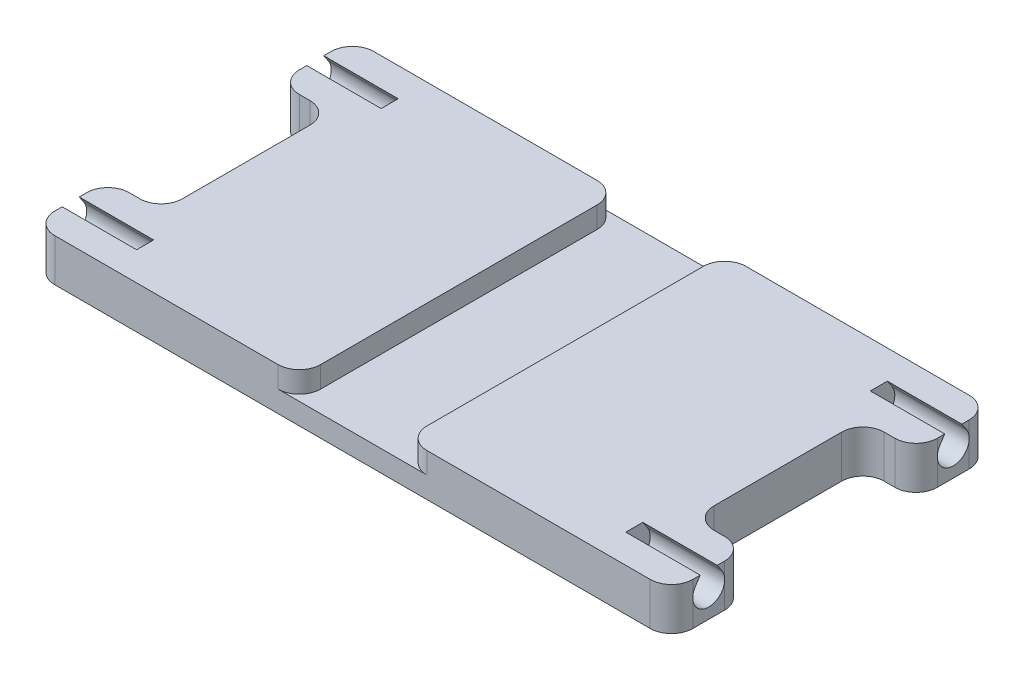
from build123d import *

# Parameters (mm, degrees)
BOSS_EXTRUDE1_DEPTH  = 2
CUT_EXTRUDE1_DEPTH   = 7
MIRROR2_COPY_1_DEPTH = 7
SKETCH4_W            = 10
SKETCH4_H            = 30
CUT_EXTRUDE2_DEPTH   = 2
FILLET1_R            = 2


with BuildPart() as part:
    # Sketch2 → Boss-Extrude1 (new, symmetric)
    with BuildSketch(Plane(origin=(0, 0, 0), x_dir=(1, 0, 0), z_dir=(0, 1, 0))):
        Polygon((-25, -8), (-30, -8), (-30, -15), (30, -15), (30, -8), (25, -8), (25, 8), (30, 8), (30, 15), (-30, 15), (-30, 8), (-25, 8), align=None)
    extrude(amount=BOSS_EXTRUDE1_DEPTH, both=True)

    # Sketch3 → Cut-Extrude1 (cut)
    with BuildSketch(Plane(origin=(30, 0, 0), x_dir=(0, 0, -1), z_dir=(1, 0, 0))):
        with BuildLine():
            Line((-12.3, 2), (-12.74567474, 1.335640138))
            ThreePointArc((-12.74567474, 1.335640138), (-11.5, -1), (-10.25432526, 1.335640138))
            Line((-10.25432526, 1.335640138), (-10.7, 2))
            Line((-10.7, 2), (-12.3, 2))
        make_face()
    cut_extrude1 = extrude(amount=-CUT_EXTRUDE1_DEPTH, mode=Mode.SUBTRACT)

    # Mirror1: Cut-Extrude1 across plane
    add(cut_extrude1.mirror(Plane(origin=(0, 0, 0), x_dir=(0, 0, 1), z_dir=(1, 0, 0))), mode=Mode.SUBTRACT)

    # Mirror2: Cut-Extrude1 across plane
    add(cut_extrude1.mirror(Plane.XY), mode=Mode.SUBTRACT)

    # Mirror2 copy 1 sketch → Mirror2 copy 1 (cut)
    with BuildSketch(Plane.ZY.offset(30)):
        with BuildLine():
            Line((-12.3, 2), (-12.74567474, 1.335640138))
            ThreePointArc((-12.74567474, 1.335640138), (-11.5, -1), (-10.25432526, 1.335640138))
            Line((-10.25432526, 1.335640138), (-10.7, 2))
            Line((-10.7, 2), (-12.3, 2))
        make_face()
    extrude(amount=-MIRROR2_COPY_1_DEPTH, mode=Mode.SUBTRACT)

    # Sketch4 → Cut-Extrude2 (cut)
    with BuildSketch(Plane(origin=(0, 2, 0), x_dir=(1, 0, 0), z_dir=(0, 1, 0))):
        Rectangle(SKETCH4_W, SKETCH4_H)
    extrude(amount=-CUT_EXTRUDE2_DEPTH, mode=Mode.SUBTRACT)

    # Fillet1
    fillet1_edges = [part.edges().sort_by_distance(p)[0] for p in [
        (5, 1, -15),
        (5, 1, 15),
        (-5, 1, 15),
        (-5, 1, -15),
        (-25, 0, -8),
        (-30, 0, -8),
        (-30, 0, -15),
        (30, 0, -15),
        (30, 0, -8),
        (25, 0, -8),
        (25, 0, 8),
        (30, 0, 8),
        (30, 0, 15),
        (-30, 0, 15),
        (-30, 0, 8),
        (-25, 0, 8),
    ]]
    fillet(fillet1_edges, radius=FILLET1_R - 0.0001)  # a hair under: the kernel refuses the full size


solid = part.part
